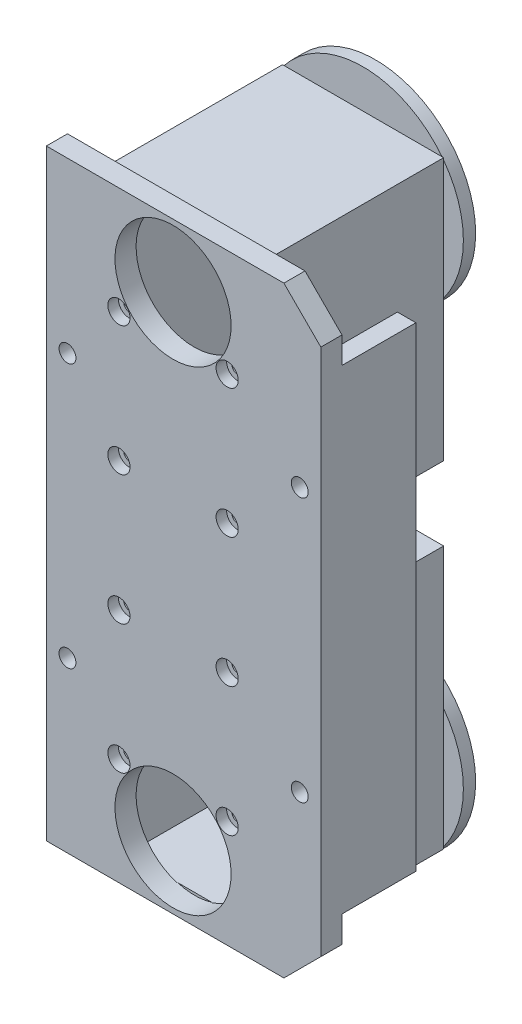
from build123d import *

# Parameters (mm, degrees)
BOSS_1_DEPTH  = 4
S_BOX2_W      = 3.5
S_BOX2_H      = 90
BOSS_2_DEPTH  = 14.5
S_BOX3_W      = 3.5
S_BOX3_H      = 90
BOSS_3_DEPTH  = 14.5
S_BOX4_W      = 30.52
S_BOX4_H      = 2.5
BOSS_4_DEPTH  = 36
S_BOX5_W      = 30.52
S_BOX5_H      = 1.2
BOSS_5_DEPTH  = 36
S_BOX6_W      = 2.5
S_BOX6_H      = 49.72
BOSS_6_DEPTH  = 36
S_BOX7_W      = 2.5
S_BOX7_H      = 49.72
BOSS_7_DEPTH  = 36
S_BOX8_W      = 30.52
S_BOX8_H      = 49.72
BOSS_8_DEPTH  = 4
S_CYL9_R      = 19
BOSS_9_DEPTH  = 2.325
S_BOX10_W     = 30.52
S_BOX10_H     = 1.2
BOSS_10_DEPTH = 36
S_BOX11_W     = 30.52
S_BOX11_H     = 2.5
BOSS_11_DEPTH = 36
S_BOX12_W     = 2.5
S_BOX12_H     = 49.72
BOSS_12_DEPTH = 36
S_BOX13_W     = 2.5
S_BOX13_H     = 49.72
BOSS_13_DEPTH = 36
S_BOX14_W     = 30.52
S_BOX14_H     = 49.72
BOSS_14_DEPTH = 4
S_CYL15_R     = 19
BOSS_15_DEPTH = 2.325
S_HOLE16_R    = 11
HOLE_16_DEPTH = 4.2
S_HOLE17_R    = 1.1
HOLE_17_DEPTH = 4.2
S_HOLE18_R    = 2.1
HOLE_18_DEPTH = 2.1
S_HOLE19_R    = 1.1
HOLE_19_DEPTH = 4.2
S_HOLE20_R    = 2.1
HOLE_20_DEPTH = 2.1
S_HOLE21_R    = 1.1
HOLE_21_DEPTH = 4.2
S_HOLE22_R    = 2.1
HOLE_22_DEPTH = 2.1
S_HOLE23_R    = 1.1
HOLE_23_DEPTH = 4.2
S_HOLE24_R    = 2.1
HOLE_24_DEPTH = 2.1
S_HOLE25_R    = 11.5
HOLE_25_DEPTH = 2.525
S_HOLE26_R    = 11
HOLE_26_DEPTH = 4.2
S_HOLE27_R    = 1.1
HOLE_27_DEPTH = 4.2
S_HOLE28_R    = 2.1
HOLE_28_DEPTH = 2.1
S_HOLE29_R    = 1.1
HOLE_29_DEPTH = 4.2
S_HOLE30_R    = 2.1
HOLE_30_DEPTH = 2.1
S_HOLE31_R    = 1.1
HOLE_31_DEPTH = 4.2
S_HOLE32_R    = 2.1
HOLE_32_DEPTH = 2.1
S_HOLE33_R    = 1.1
HOLE_33_DEPTH = 4.2
S_HOLE34_R    = 2.1
HOLE_34_DEPTH = 2.1
S_HOLE35_R    = 11.5
HOLE_35_DEPTH = 2.525
S_HOLE36_R    = 1.6
HOLE_36_DEPTH = 4.2
S_HOLE37_R    = 1.6
HOLE_37_DEPTH = 4.2
S_HOLE38_R    = 1.6
HOLE_38_DEPTH = 4.2
S_HOLE39_R    = 1.6
HOLE_39_DEPTH = 4.2


with BuildPart() as part:
    # S_prism1 → Boss_1 (new body)
    with BuildSketch(Plane.XY.offset(64.625)):
        Polygon((28, -50), (28, 50), (21, 57), (-24, 57), (-24, -57), (21, -57), align=None)
    extrude(amount=BOSS_1_DEPTH)

    # S_box2 → Boss_2 (add)
    with BuildSketch(Plane.XY.offset(50.625)):
        with Locations((26.25, 0)):
            Rectangle(S_BOX2_W, S_BOX2_H)
    extrude(amount=BOSS_2_DEPTH)

    # S_box3 → Boss_3 (add)
    with BuildSketch(Plane.XY.offset(50.625)):
        with Locations((-22.25, 0)):
            Rectangle(S_BOX3_W, S_BOX3_H)
    extrude(amount=BOSS_3_DEPTH)

    # S_box4 → Boss_4 (add)
    with BuildSketch(Plane.XY.offset(32.625)):
        with Locations((0, 8.24)):
            Rectangle(S_BOX4_W, S_BOX4_H)
    extrude(amount=BOSS_4_DEPTH)

    # S_box5 → Boss_5 (add)
    with BuildSketch(Plane.XY.offset(32.625)):
        with Locations((0, 56.11)):
            Rectangle(S_BOX5_W, S_BOX5_H)
    extrude(amount=BOSS_5_DEPTH)

    # S_box6 → Boss_6 (add)
    with BuildSketch(Plane.XY.offset(32.625)):
        with Locations((-14.01, 31.85)):
            Rectangle(S_BOX6_W, S_BOX6_H)
    extrude(amount=BOSS_6_DEPTH)

    # S_box7 → Boss_7 (add)
    with BuildSketch(Plane.XY.offset(32.625)):
        with Locations((14.01, 31.85)):
            Rectangle(S_BOX7_W, S_BOX7_H)
    extrude(amount=BOSS_7_DEPTH)

    # S_box8 → Boss_8 (add)
    with BuildSketch(Plane.XY.offset(64.625)):
        with Locations((0, 31.85)):
            Rectangle(S_BOX8_W, S_BOX8_H)
    extrude(amount=BOSS_8_DEPTH)

    # S_cyl9 → Boss_9 (add)
    with BuildSketch(Plane.XY.offset(30.3)):
        with Locations((0, 45)):
            Circle(S_CYL9_R)
    extrude(amount=BOSS_9_DEPTH)

    # S_box10 → Boss_10 (add)
    with BuildSketch(Plane.XY.offset(32.625)):
        with Locations((0, -56.11)):
            Rectangle(S_BOX10_W, S_BOX10_H)
    extrude(amount=BOSS_10_DEPTH)

    # S_box11 → Boss_11 (add)
    with BuildSketch(Plane.XY.offset(32.625)):
        with Locations((0, -8.24)):
            Rectangle(S_BOX11_W, S_BOX11_H)
    extrude(amount=BOSS_11_DEPTH)

    # S_box12 → Boss_12 (add)
    with BuildSketch(Plane.XY.offset(32.625)):
        with Locations((-14.01, -31.85)):
            Rectangle(S_BOX12_W, S_BOX12_H)
    extrude(amount=BOSS_12_DEPTH)

    # S_box13 → Boss_13 (add)
    with BuildSketch(Plane.XY.offset(32.625)):
        with Locations((14.01, -31.85)):
            Rectangle(S_BOX13_W, S_BOX13_H)
    extrude(amount=BOSS_13_DEPTH)

    # S_box14 → Boss_14 (add)
    with BuildSketch(Plane.XY.offset(64.625)):
        with Locations((0, -31.85)):
            Rectangle(S_BOX14_W, S_BOX14_H)
    extrude(amount=BOSS_14_DEPTH)

    # S_cyl15 → Boss_15 (add)
    with BuildSketch(Plane.XY.offset(30.3)):
        with Locations((0, -45)):
            Circle(S_CYL15_R)
    extrude(amount=BOSS_15_DEPTH)

    # S_hole16 → Hole_16 (cut)
    with BuildSketch(Plane.XY.offset(64.525)):
        with Locations((0, 45)):
            Circle(S_HOLE16_R)
    extrude(amount=HOLE_16_DEPTH, mode=Mode.SUBTRACT)

    # S_hole17 → Hole_17 (cut)
    with BuildSketch(Plane.XY.offset(64.525)):
        with Locations((-10.25, 36.7)):
            Circle(S_HOLE17_R)
    extrude(amount=HOLE_17_DEPTH, mode=Mode.SUBTRACT)

    # S_hole18 → Hole_18 (cut)
    with BuildSketch(Plane.XY.offset(66.625)):
        with Locations((-10.25, 36.7)):
            Circle(S_HOLE18_R)
    extrude(amount=HOLE_18_DEPTH, mode=Mode.SUBTRACT)

    # S_hole19 → Hole_19 (cut)
    with BuildSketch(Plane.XY.offset(64.525)):
        with Locations((10.25, 36.7)):
            Circle(S_HOLE19_R)
    extrude(amount=HOLE_19_DEPTH, mode=Mode.SUBTRACT)

    # S_hole20 → Hole_20 (cut)
    with BuildSketch(Plane.XY.offset(66.625)):
        with Locations((10.25, 36.7)):
            Circle(S_HOLE20_R)
    extrude(amount=HOLE_20_DEPTH, mode=Mode.SUBTRACT)

    # S_hole21 → Hole_21 (cut)
    with BuildSketch(Plane.XY.offset(64.525)):
        with Locations((-10.25, 12.25)):
            Circle(S_HOLE21_R)
    extrude(amount=HOLE_21_DEPTH, mode=Mode.SUBTRACT)

    # S_hole22 → Hole_22 (cut)
    with BuildSketch(Plane.XY.offset(66.625)):
        with Locations((-10.25, 12.25)):
            Circle(S_HOLE22_R)
    extrude(amount=HOLE_22_DEPTH, mode=Mode.SUBTRACT)

    # S_hole23 → Hole_23 (cut)
    with BuildSketch(Plane.XY.offset(64.525)):
        with Locations((10.25, 12.25)):
            Circle(S_HOLE23_R)
    extrude(amount=HOLE_23_DEPTH, mode=Mode.SUBTRACT)

    # S_hole24 → Hole_24 (cut)
    with BuildSketch(Plane.XY.offset(66.625)):
        with Locations((10.25, 12.25)):
            Circle(S_HOLE24_R)
    extrude(amount=HOLE_24_DEPTH, mode=Mode.SUBTRACT)

    # S_hole25 → Hole_25 (cut)
    with BuildSketch(Plane.XY.offset(30.2)):
        with Locations((0, 45)):
            Circle(S_HOLE25_R)
    extrude(amount=HOLE_25_DEPTH, mode=Mode.SUBTRACT)

    # S_hole26 → Hole_26 (cut)
    with BuildSketch(Plane.XY.offset(64.525)):
        with Locations((0, -45)):
            Circle(S_HOLE26_R)
    extrude(amount=HOLE_26_DEPTH, mode=Mode.SUBTRACT)

    # S_hole27 → Hole_27 (cut)
    with BuildSketch(Plane.XY.offset(64.525)):
        with Locations((-10.25, -36.7)):
            Circle(S_HOLE27_R)
    extrude(amount=HOLE_27_DEPTH, mode=Mode.SUBTRACT)

    # S_hole28 → Hole_28 (cut)
    with BuildSketch(Plane.XY.offset(66.625)):
        with Locations((-10.25, -36.7)):
            Circle(S_HOLE28_R)
    extrude(amount=HOLE_28_DEPTH, mode=Mode.SUBTRACT)

    # S_hole29 → Hole_29 (cut)
    with BuildSketch(Plane.XY.offset(64.525)):
        with Locations((10.25, -36.7)):
            Circle(S_HOLE29_R)
    extrude(amount=HOLE_29_DEPTH, mode=Mode.SUBTRACT)

    # S_hole30 → Hole_30 (cut)
    with BuildSketch(Plane.XY.offset(66.625)):
        with Locations((10.25, -36.7)):
            Circle(S_HOLE30_R)
    extrude(amount=HOLE_30_DEPTH, mode=Mode.SUBTRACT)

    # S_hole31 → Hole_31 (cut)
    with BuildSketch(Plane.XY.offset(64.525)):
        with Locations((-10.25, -12.25)):
            Circle(S_HOLE31_R)
    extrude(amount=HOLE_31_DEPTH, mode=Mode.SUBTRACT)

    # S_hole32 → Hole_32 (cut)
    with BuildSketch(Plane.XY.offset(66.625)):
        with Locations((-10.25, -12.25)):
            Circle(S_HOLE32_R)
    extrude(amount=HOLE_32_DEPTH, mode=Mode.SUBTRACT)

    # S_hole33 → Hole_33 (cut)
    with BuildSketch(Plane.XY.offset(64.525)):
        with Locations((10.25, -12.25)):
            Circle(S_HOLE33_R)
    extrude(amount=HOLE_33_DEPTH, mode=Mode.SUBTRACT)

    # S_hole34 → Hole_34 (cut)
    with BuildSketch(Plane.XY.offset(66.625)):
        with Locations((10.25, -12.25)):
            Circle(S_HOLE34_R)
    extrude(amount=HOLE_34_DEPTH, mode=Mode.SUBTRACT)

    # S_hole35 → Hole_35 (cut)
    with BuildSketch(Plane.XY.offset(30.2)):
        with Locations((0, -45)):
            Circle(S_HOLE35_R)
    extrude(amount=HOLE_35_DEPTH, mode=Mode.SUBTRACT)

    # S_hole36 → Hole_36 (cut)
    with BuildSketch(Plane.XY.offset(64.525)):
        with Locations((-20, -25)):
            Circle(S_HOLE36_R)
    extrude(amount=HOLE_36_DEPTH, mode=Mode.SUBTRACT)

    # S_hole37 → Hole_37 (cut)
    with BuildSketch(Plane.XY.offset(64.525)):
        with Locations((-20, 25)):
            Circle(S_HOLE37_R)
    extrude(amount=HOLE_37_DEPTH, mode=Mode.SUBTRACT)

    # S_hole38 → Hole_38 (cut)
    with BuildSketch(Plane.XY.offset(64.525)):
        with Locations((24, -25)):
            Circle(S_HOLE38_R)
    extrude(amount=HOLE_38_DEPTH, mode=Mode.SUBTRACT)

    # S_hole39 → Hole_39 (cut)
    with BuildSketch(Plane.XY.offset(64.525)):
        with Locations((24, 25)):
            Circle(S_HOLE39_R)
    extrude(amount=HOLE_39_DEPTH, mode=Mode.SUBTRACT)


solid = part.part
